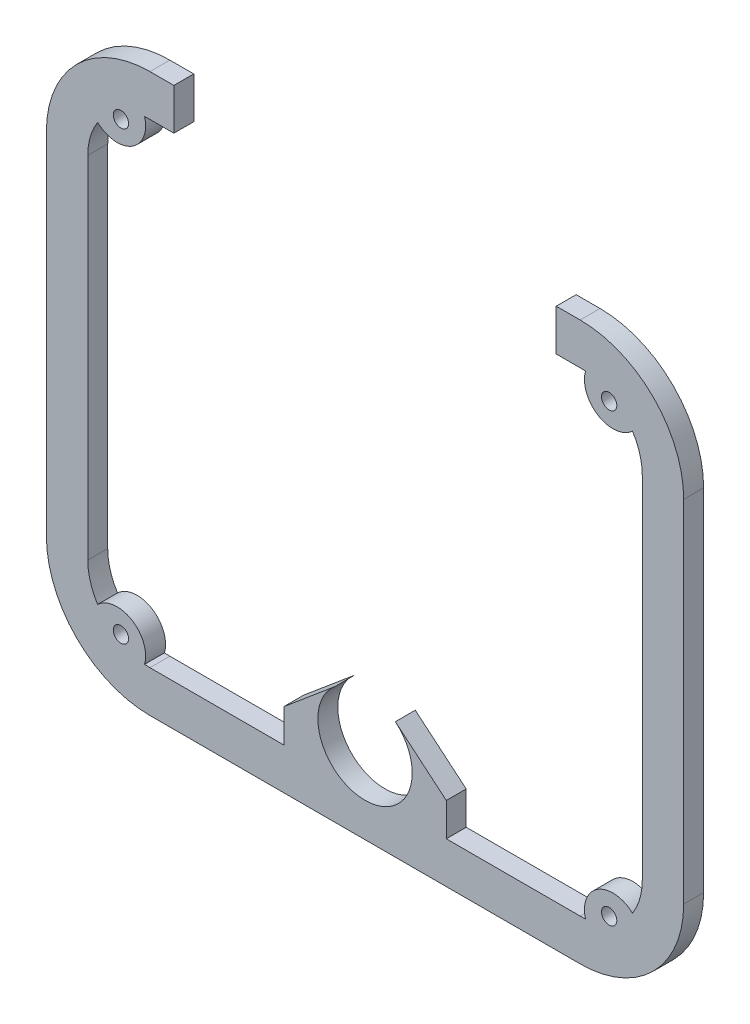
from build123d import *

# Parameters (mm, degrees)
SKETCH1_R           = 0.6096
BOSS_EXTRUDE1_DEPTH = 1.5875
CUT_EXTRUDE1_REACH  = 35.788
SKETCH2_W           = 3.155094666
SKETCH2_H           = 2.647438771
SKETCH2_W_2         = 30.48
SKETCH2_H_2         = 3.302


with BuildPart() as part:
    # Sketch1 → Boss-Extrude1 (new body)
    with BuildSketch(Plane.XY):
        with BuildLine():
            ThreePointArc((25.4, 13.97), (22.982166479, 19.807166479), (17.145, 22.225))
            Line((17.145, 22.225), (-17.145, 22.225))
            ThreePointArc((-17.145, 22.225), (-22.982166479, 19.807166479), (-25.4, 13.97))
            Line((-25.4, 13.97), (-25.4, -13.97))
            ThreePointArc((-25.4, -13.97), (-22.982166479, -19.807166479), (-17.145, -22.225))
            Line((-17.145, -22.225), (17.145, -22.225))
            ThreePointArc((17.145, -22.225), (22.982166479, -19.807166479), (25.4, -13.97))
            Line((25.4, -13.97), (25.4, 13.97))
        make_face()
        with Locations((-19.457528855, -17.78)):
            Circle(SKETCH1_R, mode=Mode.SUBTRACT)
        with BuildLine():
            ThreePointArc((-17.571441005, -18.904608097), (-18.58472515, -16.350943325), (-21.316849854, -16.639808568))
            ThreePointArc((-21.316849854, -16.639808568), (-21.898702837, -15.360869633), (-22.098, -13.97))
            Line((-22.098, -13.97), (-22.098, 13.97))
            ThreePointArc((-22.098, 13.97), (-21.898702837, 15.360869633), (-21.316849854, 16.639808568))
            ThreePointArc((-21.316849854, 16.639808568), (-18.58472515, 16.350943325), (-17.571441005, 18.904608097))
            ThreePointArc((-17.571441005, 18.904608097), (-17.358418716, 18.918399888), (-17.145, 18.923))
            Line((-17.145, 18.923), (17.145, 18.923))
            ThreePointArc((17.145, 18.923), (17.358418716, 18.918399888), (17.571441005, 18.904608097))
            ThreePointArc((17.571441005, 18.904608097), (18.58472515, 16.350943325), (21.316849854, 16.639808568))
            ThreePointArc((21.316849854, 16.639808568), (21.898702837, 15.360869633), (22.098, 13.97))
            Line((22.098, 13.97), (22.098, -13.97))
            ThreePointArc((22.098, -13.97), (21.898702837, -15.360869633), (21.316849854, -16.639808568))
            ThreePointArc((21.316849854, -16.639808568), (18.58472515, -16.350943325), (17.571441005, -18.904608097))
            ThreePointArc((17.571441005, -18.904608097), (17.358418716, -18.918399888), (17.145, -18.923))
            Line((17.145, -18.923), (9.632094666, -18.923))
            Line((9.632094666, -18.923), (2.416367182, -12.868285729))
            ThreePointArc((2.416367182, -12.868285729), (0, -19.5072), (-2.416367182, -12.868285729))
            Line((-2.416367182, -12.868285729), (-9.632094666, -18.923))
            Line((-9.632094666, -18.923), (-17.145, -18.923))
            ThreePointArc((-17.145, -18.923), (-17.358418716, -18.918399888), (-17.571441005, -18.904608097))
        make_face(mode=Mode.SUBTRACT)
        with Locations((19.457528855, -17.78)):
            Circle(SKETCH1_R, mode=Mode.SUBTRACT)
        with Locations((19.457528855, 17.78)):
            Circle(SKETCH1_R, mode=Mode.SUBTRACT)
        with Locations((-19.457528855, 17.78)):
            Circle(SKETCH1_R, mode=Mode.SUBTRACT)
    extrude(amount=BOSS_EXTRUDE1_DEPTH)

    # Sketch2 → Cut-Extrude1 (cut, up to next)
    with BuildSketch(Plane.XY.offset(1.5875), mode=Mode.PRIVATE) as cut_extrude1_sk1:
        with Locations((-8.054547333, -17.599280615)):
            Rectangle(SKETCH2_W, SKETCH2_H)
    cut_extrude1_tool1 = extrude(cut_extrude1_sk1.sketch, amount=-CUT_EXTRUDE1_REACH, mode=Mode.PRIVATE) & part.part
    # Sketch2 → Cut-Extrude1 (cut, up to next)
    with BuildSketch(Plane.XY.offset(1.5875), mode=Mode.PRIVATE) as cut_extrude1_sk2:
        with Locations((8.054547333, -17.599280615)):
            Rectangle(SKETCH2_W, SKETCH2_H)
    cut_extrude1_tool2 = extrude(cut_extrude1_sk2.sketch, amount=-CUT_EXTRUDE1_REACH, mode=Mode.PRIVATE) & part.part
    # Sketch2 → Cut-Extrude1 (cut, up to next)
    with BuildSketch(Plane.XY.offset(1.5875), mode=Mode.PRIVATE) as cut_extrude1_sk3:
        with Locations((0, 20.574)):
            Rectangle(SKETCH2_W_2, SKETCH2_H_2)
    cut_extrude1_tool3 = extrude(cut_extrude1_sk3.sketch, amount=-CUT_EXTRUDE1_REACH, mode=Mode.PRIVATE) & part.part
    add(cut_extrude1_tool1.solids().sort_by_distance((-8.054547, -17.599281, 1.5875))[0], mode=Mode.SUBTRACT)
    add(cut_extrude1_tool2.solids().sort_by_distance((8.054547, -17.599281, 1.5875))[0], mode=Mode.SUBTRACT)
    add(cut_extrude1_tool3.solids().sort_by_distance((0, 20.574, 1.5875))[0], mode=Mode.SUBTRACT)


solid = part.part
